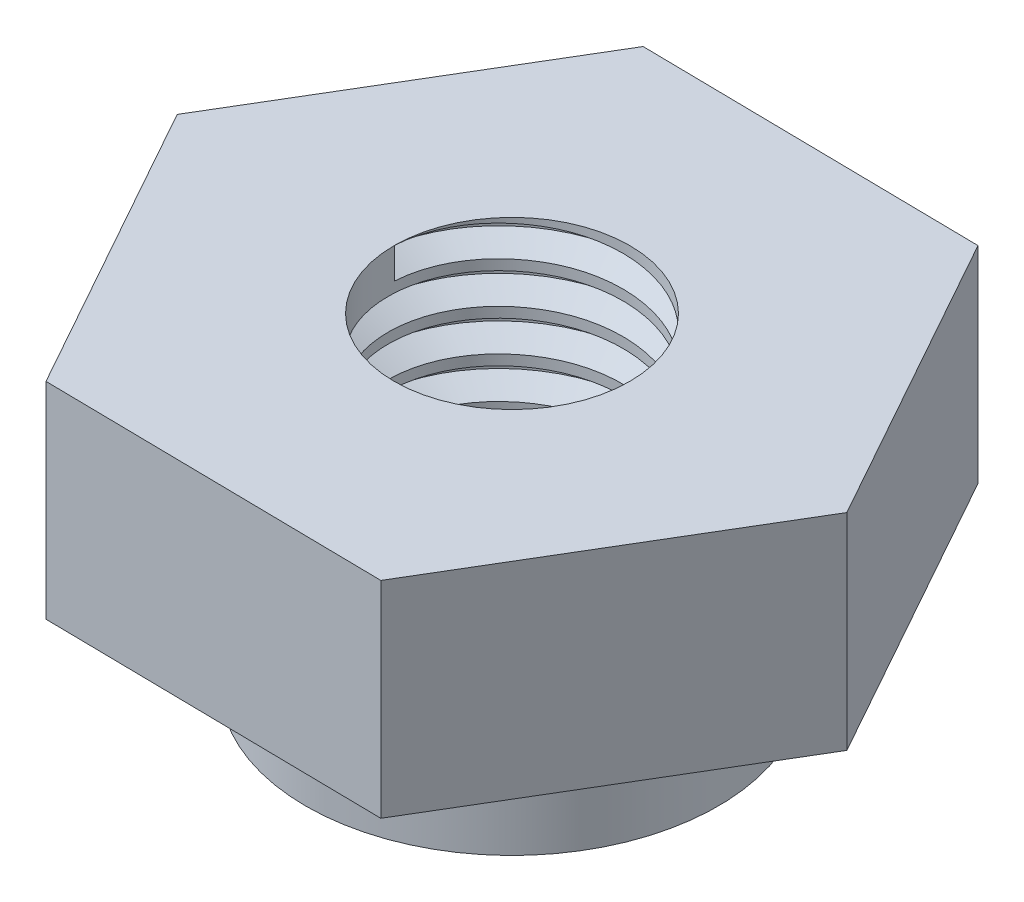
from build123d import *

# Parameters (mm, degrees)
CROQUIS1_R              = 2
SALIENTE_EXTRUIR1_DEPTH = 3.5
ROSCA1_PITCH            = 0.7
CROQUIS2_R              = 3.5
CROQUIS2_R_2            = 2.25
SALIENTE_EXTRUIR2_DEPTH = 2


with BuildPart() as part:
    # Croquis1 → Saliente-Extruir1 (new body)
    with BuildSketch(Plane(origin=(0, 0, 0), x_dir=(1, 0, 0), z_dir=(0, 1, 0))):
        Polygon((2.959554739, 4.957254188), (-2.81333069, 5.041676682), (-5.772885429, 0.084422494), (-2.959554739, -4.957254188), (2.81333069, -5.041676682), (5.772885429, -0.084422494), align=None)
        with Locations(Location((0, 0, 0), (0, 0, 270))):
            Circle(CROQUIS1_R, mode=Mode.SUBTRACT)
    extrude(amount=SALIENTE_EXTRUIR1_DEPTH)

    # Rosca1: the profile of Perfil de rosca1 profile screwed along a right-hand helix of 5 turns, 6 arcs to a turn; built about Z, then put on its axis
    rosca1_z = Axis((0, 0, 0), (0, 0, 1))
    rosca1_corners = [(1.9997, 0, -0.000173205), (2.378886113, 0, 0.218749999), (2.378886113, 0, 0.306249999), (1.9997, 0, 0.525173203)]
    with BuildLine(mode=Mode.PRIVATE) as rosca1_profile:
        Line(rosca1_corners[0], rosca1_corners[1])
        Line(rosca1_corners[1], rosca1_corners[2])
        Line(rosca1_corners[2], rosca1_corners[3])
        Line(rosca1_corners[3], rosca1_corners[0])
    rosca1_cap = Face(rosca1_profile.wire())
    rosca1_turn_angles = [0, 30, 60, 90, 120, 150, 180, 210, 240, 270, 300, 330, 360]
    rosca1_turn_weights = [1, 0.8660254037844387, 1, 0.8660254037844387, 1, 0.8660254037844387, 1, 0.8660254037844387, 1, 0.8660254037844387, 1, 0.8660254037844387, 1]
    rosca1_turn_rails = [Edge.make_bspline([Vector(p[0], p[1], 0).rotate(rosca1_z, rosca1_turn_angles[k]) / rosca1_turn_weights[k] + Vector(0, 0, p[2] + ROSCA1_PITCH * rosca1_turn_angles[k] / 360) for k in range(13)], [0, 0, 0, 1, 1, 2, 2, 3, 3, 4, 4, 5, 5, 6, 6, 6], 2, rosca1_turn_weights) for p in rosca1_corners]
    rosca1_turn_sides = [Face.make_surface_from_curves(rosca1_turn_rails[p[0]], rosca1_turn_rails[p[1]]) for p in [(0, 1), (1, 2), (2, 3), (3, 0)]]
    rosca1 = Plane(origin=(0, 3.5, 0), x_dir=(-1, 0, 0), z_dir=(0, -1, 0)) * Solid(Shell([*[p.moved(Location((0, 0, ROSCA1_PITCH * i))) for i in range(5) for p in rosca1_turn_sides], rosca1_cap, rosca1_cap.rotate(rosca1_z, 1800).moved(Location((0, 0, ROSCA1_PITCH * 1800 / 360)))]))
    add(rosca1, mode=Mode.SUBTRACT)

    # Croquis2 → Saliente-Extruir2 (add)
    with BuildSketch(Plane.XZ):
        with Locations(Location((0, 0, 0), (0, 0, 90))):
            Circle(CROQUIS2_R)
        with Locations(Location((0, 0, 0), (0, 0, 105.23750757))):
            Circle(CROQUIS2_R_2, mode=Mode.SUBTRACT)
    extrude(amount=SALIENTE_EXTRUIR2_DEPTH)


solid = part.part
